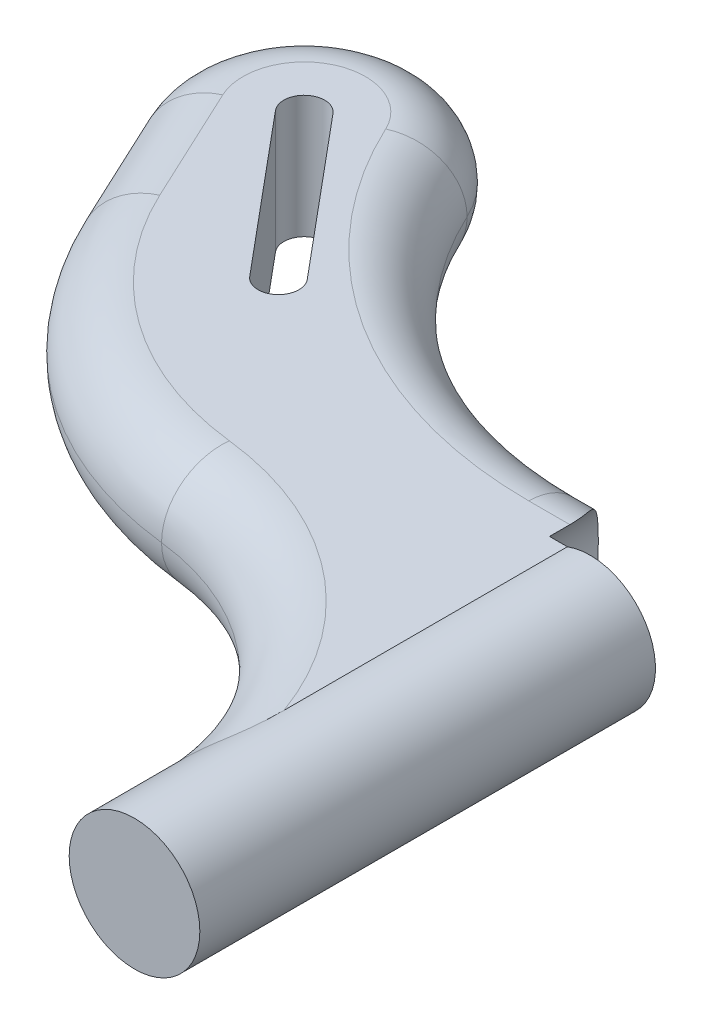
from build123d import *

# Parameters (mm, degrees)
SKETCH1_R           = 8
BOSS_EXTRUDE1_DEPTH = 55.781202295
BOSS_EXTRUDE2_DEPTH = 7.5
SKETCH4_W           = 9
SKETCH4_H           = 15
FILLET7_R           = 7.5


with BuildPart() as part:
    # Sketch1 → Boss-Extrude1 (new body)
    with BuildSketch(Plane.XY):
        with Locations(Location((0, 0, 0), (0, 0, 180))):
            Circle(SKETCH1_R)
    extrude(amount=BOSS_EXTRUDE1_DEPTH)

    # Sketch2 → Boss-Extrude2 (add, symmetric)
    with BuildSketch(Plane(origin=(0, 0, 0), x_dir=(1, 0, 0), z_dir=(0, 1, 0))):
        with BuildLine():
            Line((0, 0), (0, -47.781202295))
            Line((0, -47.781202295), (-8, -47.781202295))
            ThreePointArc((-8, -47.781202295), (-15.893349065, -27.087541453), (-35.563103488, -16.907496293))
            ThreePointArc((-35.563103488, -16.907496293), (-57.085036764, -8.603159393), (-71.811764706, 9.152941176))
            Line((-71.811764706, 9.152941176), (-78.588235294, 23.647058824))
            ThreePointArc((-78.588235294, 23.647058824), (-71.352941176, 43.588235294), (-51.411764706, 36.352941176))
            ThreePointArc((-51.411764706, 36.352941176), (-34.542879643, 17.146903418), (-10, 10))
            Line((-10, 10), (0, 10))
            Line((0, 10), (0, 0))
        make_face()
        with BuildLine():
            Line((-66.918339779, 28.396886626), (-50.887206037, 9.213488831))
            ThreePointArc((-50.887206037, 9.213488831), (-47.365752883, 8.898262426), (-47.050526478, 12.41971558))
            Line((-47.050526478, 12.41971558), (-63.081660221, 31.603113374))
            ThreePointArc((-63.081660221, 31.603113374), (-66.603113374, 31.918339779), (-66.918339779, 28.396886626))
        make_face(mode=Mode.SUBTRACT)
    extrude(amount=BOSS_EXTRUDE2_DEPTH, both=True)

    # Sketch4 → Cut-Revolve1 (revolve, cut)
    with BuildSketch(Plane(origin=(0, 0, 0), x_dir=(1, 0, 0), z_dir=(0, 1, 0))):
        with Locations((-4.5, -63.281202295)):
            Rectangle(SKETCH4_W, SKETCH4_H)
        with Locations((-4.5, 7.5)):
            Rectangle(SKETCH4_W, SKETCH4_H)
    revolve(axis=Axis((0, 0, 0), (0, 0, 1)), mode=Mode.SUBTRACT)

    # Fillet7
    # the kernel refuses this fillet: 7.5 mm, written as the material it takes off along each edge
    with BuildSketch(Plane(origin=(-10, -7.5, -10), x_dir=(0, 1, 0), z_dir=(1, 0, 0))) as fillet7_piece_1:
        with BuildLine():
            CenterArc((FILLET7_R, FILLET7_R), FILLET7_R, 180, 90)
            Line((0, FILLET7_R), (0, 0))
            Line((0, 0), (FILLET7_R, 0))
        make_face()
    extrude(amount=23.775062814, mode=Mode.SUBTRACT)
    with BuildSketch(Plane(origin=(-10, -7.5, -55.714285714), x_dir=(-0.9058823529411765, 0, 0.423529411764706), z_dir=(-0.423529411764706, 0, -0.9058823529411765))) as fillet7_piece_2:
        with BuildLine():
            CenterArc((45.714285714 + FILLET7_R, FILLET7_R), FILLET7_R, 180, 90)
            Line((45.714285714 + FILLET7_R, 0), (45.714285714, 0))
            Line((45.714285714, 0), (45.714285714, FILLET7_R))
        make_face()
    revolve(axis=Axis((-10, -7.5, -55.714285714), (0, 1, 0)), revolution_arc=64.942384582, mode=Mode.SUBTRACT)
    with BuildSketch(Plane(origin=(-65, -7.5, -30), x_dir=(-0.9058823529411761, 0, 0.42352941176470665), z_dir=(0.42352941176470665, 0, 0.9058823529411761))) as fillet7_piece_3:
        with BuildLine():
            CenterArc((15 - FILLET7_R, -FILLET7_R), FILLET7_R, 0, 90)
            Line((15 - FILLET7_R, 0), (15, 0))
            Line((15, 0), (15, -FILLET7_R))
        make_face()
    revolve(axis=Axis((-65, -7.5, -30), (0, -1, 0)), revolution_arc=180, mode=Mode.SUBTRACT)
    with BuildSketch(Plane(origin=(-71.811764706, -7.5, -9.152941176), x_dir=(0, 1, 0), z_dir=(-0.4235294117647053, 0, -0.9058823529411768))) as fillet7_piece_4:
        with BuildLine():
            CenterArc((FILLET7_R, FILLET7_R), FILLET7_R, 180, 90)
            Line((0, FILLET7_R), (0, 0))
            Line((0, 0), (FILLET7_R, 0))
        make_face()
    extrude(amount=16, mode=Mode.SUBTRACT)
    with BuildSketch(Plane(origin=(-30.4, -7.5, -28.514285714), x_dir=(-0.11294288879485842, 0, 0.9936014814152967), z_dir=(0.9936014814152967, 0, 0.11294288879485842))) as fillet7_piece_5:
        with BuildLine():
            CenterArc((45.714285714 - FILLET7_R, -FILLET7_R), FILLET7_R, 0, 90)
            Line((45.714285714 - FILLET7_R, 0), (45.714285714, 0))
            Line((45.714285714, 0), (45.714285714, -FILLET7_R))
        make_face()
    revolve(axis=Axis((-30.4, -7.5, -28.514285714), (0, -1, 0)), revolution_arc=58.45739638, mode=Mode.SUBTRACT)
    with BuildSketch(Plane(origin=(-10, 7.5, -10), x_dir=(0, -1, 0), z_dir=(1, 0, 0))) as fillet7_piece_6:
        with BuildLine():
            CenterArc((FILLET7_R, -FILLET7_R), FILLET7_R, 90, 90)
            Line((0, -FILLET7_R), (0, 0))
            Line((0, 0), (FILLET7_R, 0))
        make_face()
    extrude(amount=23.775062814, mode=Mode.SUBTRACT)
    with BuildSketch(Plane(origin=(-10, 7.5, -55.714285714), x_dir=(-0.9058823529411765, 0, 0.423529411764706), z_dir=(-0.423529411764706, 0, -0.9058823529411765))) as fillet7_piece_7:
        with BuildLine():
            CenterArc((45.714285714 + FILLET7_R, -FILLET7_R), FILLET7_R, 90, 90)
            Line((45.714285714 + FILLET7_R, 0), (45.714285714, 0))
            Line((45.714285714, 0), (45.714285714, -FILLET7_R))
        make_face()
    revolve(axis=Axis((-10, 7.5, -55.714285714), (0, 1, 0)), revolution_arc=64.942384582, mode=Mode.SUBTRACT)
    with BuildSketch(Plane(origin=(-65, 7.5, -30), x_dir=(-0.9058823529411761, 0, 0.42352941176470665), z_dir=(0.42352941176470665, 0, 0.9058823529411761))) as fillet7_piece_8:
        with BuildLine():
            CenterArc((15 - FILLET7_R, FILLET7_R), FILLET7_R, 270, 90)
            Line((15 - FILLET7_R, 0), (15, 0))
            Line((15, 0), (15, FILLET7_R))
        make_face()
    revolve(axis=Axis((-65, 7.5, -30), (0, -1, 0)), revolution_arc=180, mode=Mode.SUBTRACT)
    with BuildSketch(Plane(origin=(-71.811764706, 7.5, -9.152941176), x_dir=(0, -1, 0), z_dir=(-0.4235294117647053, 0, -0.9058823529411768))) as fillet7_piece_9:
        with BuildLine():
            CenterArc((FILLET7_R, -FILLET7_R), FILLET7_R, 90, 90)
            Line((0, -FILLET7_R), (0, 0))
            Line((0, 0), (FILLET7_R, 0))
        make_face()
    extrude(amount=16, mode=Mode.SUBTRACT)
    with BuildSketch(Plane(origin=(-30.4, 7.5, -28.514285714), x_dir=(-0.11294288879485842, 0, 0.9936014814152967), z_dir=(0.9936014814152967, 0, 0.11294288879485842))) as fillet7_piece_10:
        with BuildLine():
            CenterArc((45.714285714 - FILLET7_R, FILLET7_R), FILLET7_R, 270, 90)
            Line((45.714285714 - FILLET7_R, 0), (45.714285714, 0))
            Line((45.714285714, 0), (45.714285714, FILLET7_R))
        make_face()
    revolve(axis=Axis((-30.4, 7.5, -28.514285714), (0, -1, 0)), revolution_arc=58.45739638, mode=Mode.SUBTRACT)
    with BuildSketch(Plane(origin=(-39.072524125, -7.5, 47.781202295), x_dir=(0.8232772833721975, 0, 0.5676394231228962), z_dir=(-0.5676394231228962, 0, 0.8232772833721975))) as fillet7_piece_11_section:
        with BuildLine():
            CenterArc((31.072524125 + FILLET7_R, FILLET7_R), FILLET7_R, 180, 90)
            Line((31.072524125 + FILLET7_R, 0), (31.072524125, 0))
            Line((31.072524125, 0), (31.072524125, FILLET7_R))
        make_face()
    fillet7_piece_11 = revolve(axis=Axis((-39.072524125, -7.5, 47.781202295), (0, 1, 0)), revolution_arc=118.100790846, mode=Mode.PRIVATE)
    fillet7_piece_11 = fillet7_piece_11 - Plane(origin=(0, 0, 57.650012674), x_dir=(-1, 0, 0), z_dir=(0, 0, -1)) * Cylinder(8, 155, mode=Mode.PRIVATE)
    add(fillet7_piece_11, mode=Mode.SUBTRACT)
    with BuildSketch(Plane(origin=(-39.072524125, 7.5, 47.781202295), x_dir=(0.8232772833721975, 0, 0.5676394231228962), z_dir=(-0.5676394231228962, 0, 0.8232772833721975))) as fillet7_piece_12_section:
        with BuildLine():
            CenterArc((31.072524125 + FILLET7_R, -FILLET7_R), FILLET7_R, 90, 90)
            Line((31.072524125 + FILLET7_R, 0), (31.072524125, 0))
            Line((31.072524125, 0), (31.072524125, -FILLET7_R))
        make_face()
    fillet7_piece_12 = revolve(axis=Axis((-39.072524125, 7.5, 47.781202295), (0, 1, 0)), revolution_arc=118.100790846, mode=Mode.PRIVATE)
    fillet7_piece_12 = fillet7_piece_12 - Plane(origin=(0, 0, 57.650012673), x_dir=(-1, 0, 0), z_dir=(0, 0, -1)) * Cylinder(8, 155, mode=Mode.PRIVATE)
    add(fillet7_piece_12, mode=Mode.SUBTRACT)


solid = part.part
